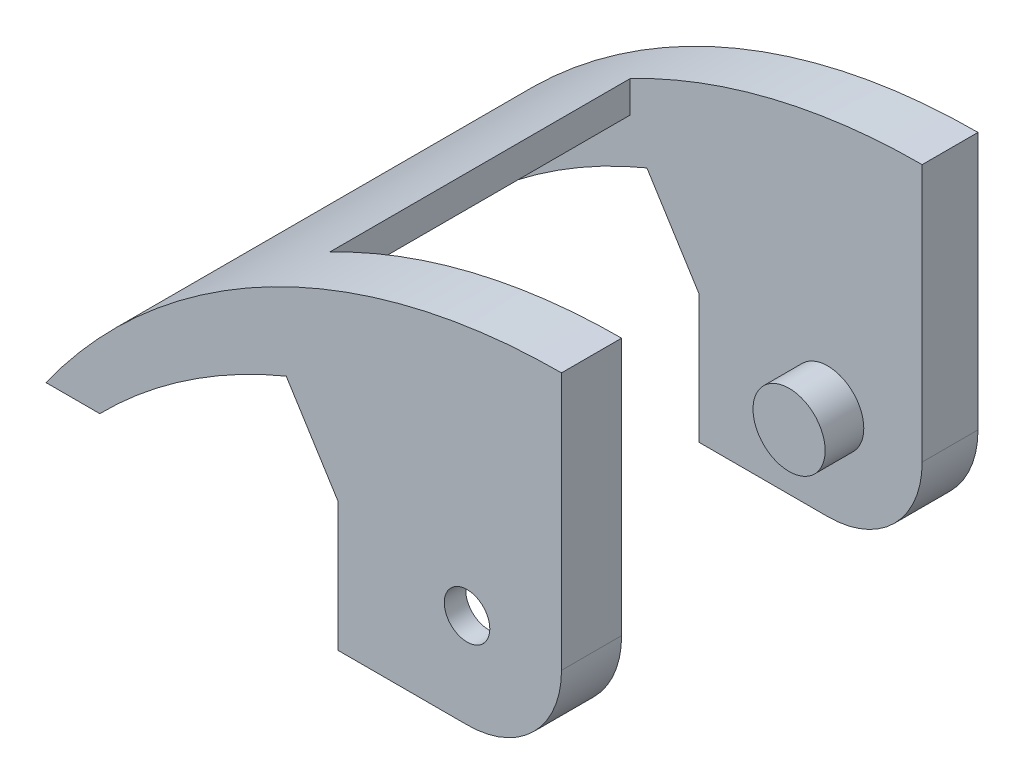
from build123d import *
from build123d.topology import SkipClean

# Parameters (mm, degrees)
SKETCH1_R                = 9.5
BOSS_EXTRUDE1_DEPTH      = 48
SKETCH2_W                = 34
SKETCH2_H                = 30
CUT_EXTRUDE1_DEPTH       = 62.481704596
BOSS_EXTRUDE2_START      = -2.5
SKETCH3_R                = 9.5
SKETCH3_R_2              = 2.4
BOSS_EXTRUDE2_DEPTH      = 2.5
SKETCH4_R                = 9.5
SKETCH4_R_2              = 4.2
BOSS_EXTRUDE3_DEPTH      = 7
SKETCH5_R                = 4.2
BOSS_EXTRUDE4_DEPTH      = 11
BOSS_EXTRUDE5_DEPTH      = 48
CUT_EXTRUDE2_START       = -48
CUT_EXTRUDE2_OUTLINE_R   = 2.65
CUT_EXTRUDE2_DEPTH       = 48
CUT_EXTRUDE3_START       = -4.5
SKETCH8_R                = 9.5
CUT_EXTRUDE3_DEPTH       = 4.5
SKETCH9_R                = 6.067807638
CUT_EXTRUDE4_DEPTH       = 4.5
SKETCH10_R               = 9.5
BOSS_EXTRUDE6_DEPTH      = 4.5
SKETCH11_R               = 4.2
BOSS_EXTRUDE7_DEPTH      = 3.5
SKETCH12_R               = 2.4
BOSS_EXTRUDE8_DEPTH      = 2.5
SKETCH13_W               = 35
SKETCH13_H               = 34
CUT_EXTRUDE5_DEPTH       = 14.5
SKETCH15_R               = 3.436413098
BOSS_EXTRUDE9_DEPTH      = 10
BOSS_EXTRUDE10_DEPTH     = 0.5
SKETCH18_R               = 4.2
CUT_EXTRUDE8_DEPTH       = 0.5
CUT_EXTRUDE9_DEPTH       = 69.529190861
BOSS_EXTRUDE11_DEPTH     = 7
CUT_EXTRUDE10_DEPTH      = 80.22909819
BOSS_EXTRUDE12_DEPTH     = 41.5
SKETCH25_R               = 4.2
CUT_EXTRUDE11_DEPTH      = 0.5
CUT_EXTRUDE12_DEPTH      = 80.22909819
CUT_EXTRUDE12_DEPTH_BACK = 80.22909819


# Read off the part's stored shape, not the designer's step: Cut-Extrude2
with BuildPart() as part:
    # Sketch1 → Boss-Extrude1 (new body)
    with BuildSketch(Plane.XY):
        with BuildLine():
            Line((-12, 0), (-12, 30))
            Line((-12, 30), (12, 30))
            Line((12, 30), (12, 0))
            ThreePointArc((12, 0), (0, -12), (-12, 0))
        make_face()
        Circle(SKETCH1_R, mode=Mode.SUBTRACT)
    extrude(amount=-BOSS_EXTRUDE1_DEPTH)

    # Sketch2 → Cut-Extrude1 (cut, through all)
    with BuildSketch(Plane.ZY.offset(12)):
        with Locations((-24, 3)):
            Rectangle(SKETCH2_W, SKETCH2_H)
    extrude(amount=-CUT_EXTRUDE1_DEPTH, mode=Mode.SUBTRACT)

    # Sketch3 → Boss-Extrude2 (add)
    with BuildSketch(Plane(origin=(0, 0, -48), x_dir=(-1, 0, 0), z_dir=(0, 0, -1)).offset(BOSS_EXTRUDE2_START)):
        Circle(SKETCH3_R)
        Circle(SKETCH3_R_2, mode=Mode.SUBTRACT)
    extrude(amount=BOSS_EXTRUDE2_DEPTH)

    # Sketch4 → Boss-Extrude3 (add)
    with BuildSketch(Plane.XY):
        with Locations(Location((0, 0, 0), (0, 0, 180))):
            Circle(SKETCH4_R)
        Circle(SKETCH4_R_2, mode=Mode.SUBTRACT)
    extrude(amount=-BOSS_EXTRUDE3_DEPTH)

    # Sketch5 → Boss-Extrude4 (add)
    with BuildSketch(Plane.XY):
        Circle(SKETCH5_R)
    extrude(amount=-BOSS_EXTRUDE4_DEPTH)

    # Sketch6 → Boss-Extrude5 (add)
    with BuildSketch(Plane(origin=(0, 0, -48), x_dir=(-1, 0, 0), z_dir=(0, 0, -1))):
        Polygon((12, 30), (12, 18), (18, 18), (38, 18), (38, 30), align=None)
    extrude(amount=-BOSS_EXTRUDE5_DEPTH)

    # Cut-Extrude2 outline → Cut-Extrude2 (cut)
    with BuildSketch(Plane.XY.offset(CUT_EXTRUDE2_START)):
        Circle(CUT_EXTRUDE2_OUTLINE_R)
    extrude(amount=CUT_EXTRUDE2_DEPTH, mode=Mode.SUBTRACT)

    # Sketch8 → Cut-Extrude3 (cut)
    with BuildSketch(Plane(origin=(0, 0, -7), x_dir=(-1, 0, 0), z_dir=(0, 0, -1)).offset(CUT_EXTRUDE3_START)):
        Circle(SKETCH8_R)
    extrude(amount=CUT_EXTRUDE3_DEPTH, mode=Mode.SUBTRACT)


with BuildPart() as cut_extrude3_piece_1:
    # of the separate pieces the step leaves, piece 1, a body of its own (cut_extrude3_pieces)
    add(part.part.solids().sort_by_distance((-12, 0, 0))[0])

    # Sketch10 → Boss-Extrude6 (add)
    with BuildSketch(Plane.XY.offset(-45.5)):
        with Locations(Location((0, 0, 0), (0, 0, 90))):
            Circle(SKETCH10_R)
    extrude(amount=BOSS_EXTRUDE6_DEPTH)

    # Sketch11 → Boss-Extrude7 (add)
    with BuildSketch(Plane.XY.offset(-41)):
        with Locations(Location((0, 0, 0), (0, 0, 180))):
            Circle(SKETCH11_R)
    extrude(amount=BOSS_EXTRUDE7_DEPTH)

    # Sketch12 → Boss-Extrude8 (add)
    with BuildSketch(Plane(origin=(0, 0, -48), x_dir=(-1, 0, 0), z_dir=(0, 0, -1))):
        Circle(SKETCH12_R)
    extrude(amount=-BOSS_EXTRUDE8_DEPTH)

    # Sketch13 → Cut-Extrude5 (cut)
    with BuildSketch(Plane(origin=(0, 30, 0), x_dir=(1, 0, 0), z_dir=(0, 1, 0))):
        with Locations((-5.5, 24)):
            Rectangle(SKETCH13_W, SKETCH13_H)
    extrude(amount=-CUT_EXTRUDE5_DEPTH, mode=Mode.SUBTRACT)

    # Sketch15 → Boss-Extrude9 (add)
    with BuildSketch(Plane(origin=(0, 0, -48), x_dir=(-1, 0, 0), z_dir=(0, 0, -1))):
        Circle(SKETCH15_R)
    extrude(amount=-BOSS_EXTRUDE9_DEPTH)

    # Sketch16 → Boss-Extrude10 (add)
    with SkipClean():  # the faces are left unmerged after this step: merging them gives an invalid solid
        with BuildSketch(Plane(origin=(0, 0, -48), x_dir=(-1, 0, 0), z_dir=(0, 0, -1))):
            Polygon((38, 30), (-12, 30), (-12, 18), (12, 18), (38, 18), align=None)
            with BuildLine():
                Line((-12, 0), (12, 0))
                ThreePointArc((12, 0), (0, -12), (-12, 0))
            make_face()
            with BuildLine():
                ThreePointArc((12, 0), (0, 12), (-12, 0))
                Line((-12, 0), (12, 0))
            make_face()
            with BuildLine():
                Line((12, 0), (-12, 0))
                ThreePointArc((-12, 0), (0, -12), (12, 0))
            make_face()
            with BuildLine():
                Line((12, 18), (-12, 18))
                Line((-12, 18), (-12, 0))
                ThreePointArc((-12, 0), (0, 12), (12, 0))
                Line((12, 0), (12, 18))
            make_face()
        extrude(amount=BOSS_EXTRUDE10_DEPTH)

    # Sketch18 → Cut-Extrude8 (cut)
    with SkipClean():  # the faces are left unmerged after this step: merging them gives an invalid solid
        with BuildSketch(Plane.XY.offset(-41)):
            with BuildLine():
                Line((12, 30), (-23, 30))
                Line((-23, 30), (-23, 18))
                Line((-23, 18), (-12, 18))
                Line((-12, 18), (-12, 0))
                ThreePointArc((-12, 0), (0, -12), (12, 0))
                Line((12, 0), (12, 30))
            make_face()
            Circle(SKETCH18_R, mode=Mode.SUBTRACT)
        extrude(amount=-CUT_EXTRUDE8_DEPTH, mode=Mode.SUBTRACT)

    # Sketch19 → Cut-Extrude9 (cut, through all)
    with SkipClean():  # the faces are left unmerged after this step: merging them gives an invalid solid
        with BuildSketch(Plane.XY):
            with BuildLine():
                ThreePointArc((11, 0), (0, -11), (-11, 0))
                Line((-11, 0), (-12, 0))
                ThreePointArc((-12, 0), (0, -12), (12, 0))
                Line((12, 0), (12, 30))
                Line((12, 30), (11, 30))
                Line((11, 30), (11, 0))
            make_face()
        extrude(amount=-CUT_EXTRUDE9_DEPTH, mode=Mode.SUBTRACT)

    # Sketch21 → Boss-Extrude11 (add)
    with SkipClean():  # the faces are left unmerged after this step: merging them gives an invalid solid
        with BuildSketch(Plane.XY):
            with BuildLine():
                Line((-55, -11), (0, -11))
                ThreePointArc((0, -11), (-7.778174593, -7.778174593), (-11, 0))
                Line((-11, 0), (-12, 0))
                Line((-12, 0), (-12, 18))
                Line((-12, 18), (-29.285566016, 18))
                ThreePointArc((-29.285566016, 18), (-44.085437149, 5.222560402), (-55, -11))
            make_face()
        boss_extrude11 = extrude(amount=-BOSS_EXTRUDE11_DEPTH)

    # Mirror2: Boss-Extrude11 across plane
    with SkipClean():  # the faces are left unmerged after this step: merging them gives an invalid solid
        add(boss_extrude11.mirror(Plane.XY.offset(-24.25)))

    # Sketch23 → Cut-Extrude10 (cut, through all)
    with SkipClean():  # the faces are left unmerged after this step: merging them gives an invalid solid
        with BuildSketch(Plane.XY):
            with BuildLine():
                Line((11, 30), (-38, 30))
                Line((-38, 30), (-38, 11.325220695))
                ThreePointArc((-38, 11.325220695), (-15.219016868, 25.173069355), (11, 30))
            make_face()
        extrude(amount=-CUT_EXTRUDE10_DEPTH, mode=Mode.SUBTRACT)

    # Sketch24 → Boss-Extrude12 (add)
    with SkipClean():  # the faces are left unmerged after this step: merging them gives an invalid solid
        with BuildSketch(Plane.XY):
            with BuildLine():
                ThreePointArc((-23, 21.6788275), (-41.60205739, 7.887419381), (-55, -11))
                Line((-55, -11), (-51.635998377, -11))
                ThreePointArc((-51.635998377, -11), (-39.486754135, 5.75970176), (-23, 18.276837089))
                Line((-23, 18.276837089), (-23, 21.6788275))
            make_face()
        extrude(amount=-BOSS_EXTRUDE12_DEPTH)

    # Sketch25 → Cut-Extrude11 (cut)
    # profile 1 of 3: a face of its own
    with BuildSketch(Plane.XY.offset(-41.5)):
        with BuildLine():
            ThreePointArc((11, 27), (-6.550595226, 24.784456384), (-23, 18.276837089))
            Line((-23, 18.276837089), (-23, 18))
            Line((-23, 18), (-23.499204657, 18))
            ThreePointArc((-23.499204657, 18), (-39.685914386, 5.555259732), (-51.635998377, -11))
            Line((-51.635998377, -11), (0, -11))
            ThreePointArc((0, -11), (-7.778174593, 7.778174593), (11, 0))
            Line((11, 0), (11, 27))
        make_face()
    # profile 2 of 3: a face of its own
    with BuildSketch(Plane.XY.offset(-41.5)):
        with BuildLine():
            ThreePointArc((0, -11), (7.778174593, -7.778174593), (11, 0))
            ThreePointArc((11, 0), (-7.778174593, 7.778174593), (0, -11))
        make_face()
        Circle(SKETCH25_R, mode=Mode.SUBTRACT)
    # profile 3 of 3: a face of its own
    with BuildSketch(Plane.XY.offset(-41.5)):
        with BuildLine():
            ThreePointArc((11, 30), (-6.501727856, 27.889455027), (-23, 21.6788275))
            Line((-23, 21.6788275), (-23, 18.276837089))
            ThreePointArc((-23, 18.276837089), (-6.550595226, 24.784456384), (11, 27))
            Line((11, 27), (11, 30))
        make_face()
    extrude(amount=-CUT_EXTRUDE11_DEPTH, mode=Mode.SUBTRACT)

    # Sketch26 → Cut-Extrude12 (cut, two sides: drawn at the far end of the back side and taken through both)
    with BuildSketch(Plane(origin=(0, 0, -48.5), x_dir=(-1, 0, 0), z_dir=(0, 0, -1)).offset(-CUT_EXTRUDE12_DEPTH_BACK)):
        with BuildLine():
            Line((15, -11), (15, 4))
            Line((15, 4), (21.056677648, 13.637195648))
            ThreePointArc((21.056677648, 13.637195648), (32.64899906, 7.412367977), (42.766432542, -1))
            Line((42.766432542, -1), (55, -1))
            Line((55, -1), (55, -11))
            Line((55, -11), (15, -11))
        make_face()
    extrude(amount=CUT_EXTRUDE12_DEPTH + CUT_EXTRUDE12_DEPTH_BACK, mode=Mode.SUBTRACT)


with BuildPart() as cut_extrude3_piece_2:
    # of the separate pieces the step leaves, piece 2, a body of its own (cut_extrude3_pieces)
    add(part.part.solids().sort_by_distance((4.2, 0, -7))[0])

    # Sketch9 → Cut-Extrude4 (cut)
    with BuildSketch(Plane(origin=(0, 0, -11), x_dir=(-1, 0, 0), z_dir=(0, 0, -1))):
        Circle(SKETCH9_R)
    extrude(amount=-CUT_EXTRUDE4_DEPTH, mode=Mode.SUBTRACT)


solid = cut_extrude3_piece_1.part
